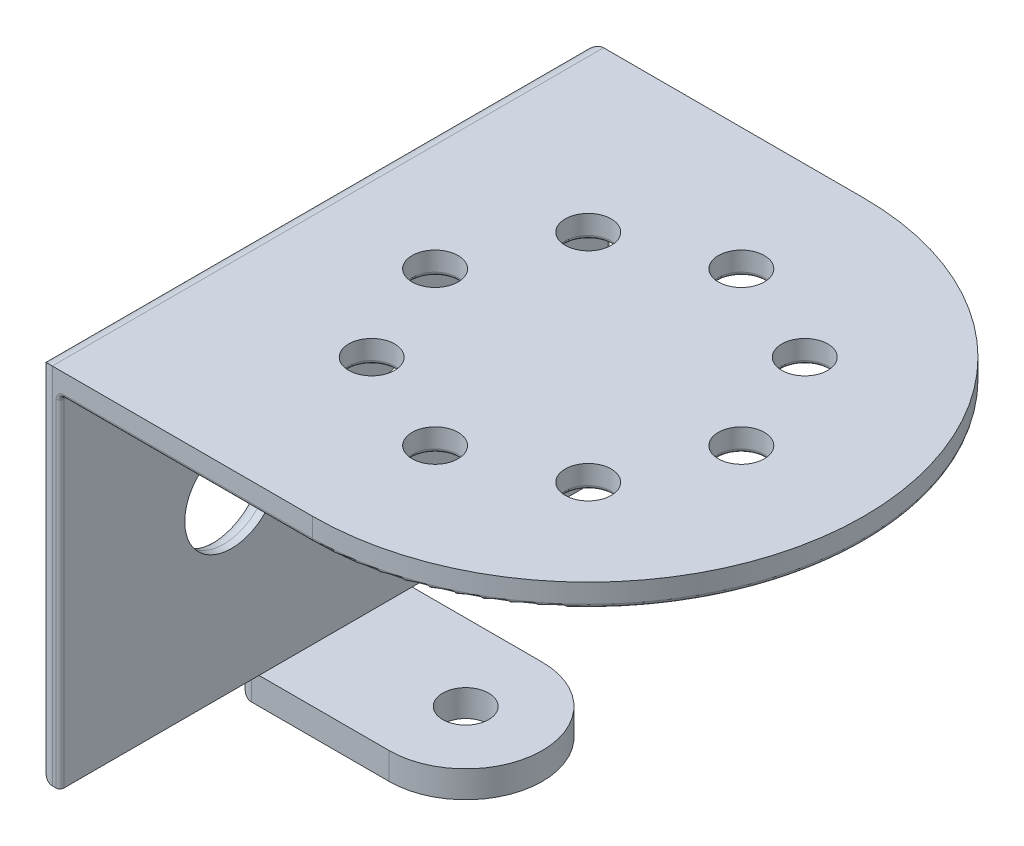
from build123d import *

# Parameters (mm, degrees)
CROQUIS1_W              = 36
CROQUIS1_H              = 22.25
CROQUIS1_R              = 1.5
CROQUIS1_R_2            = 3.05
CROQUIS1_R_3            = 1.875
SALIENTE_EXTRUIR1_DEPTH = 1.5
SALIENTE_EXTRUIR3_START = -22.25
SALIENTE_EXTRUIR3_DEPTH = 1.5
SALIENTE_EXTRUIR4_START = 22.25
CROQUIS4_W              = 1.5
CROQUIS4_H              = 10
SALIENTE_EXTRUIR4_DEPTH = 1.75
CORTAR_EXTRUIR1_REACH   = 48.734
CROQUIS5_R              = 1.5
CORTAR_EXTRUIR2_REACH   = 49.647
CROQUIS7_R              = 1.5
REDONDEO2_R             = 1
REDONDEO3_R             = 0.25


with BuildPart() as part:
    # Croquis1 → Saliente-Extruir1 (new body)
    with BuildSketch(Plane(origin=(0, 0, 0), x_dir=(0, 0, -1), z_dir=(1, 0, 0))):
        Rectangle(CROQUIS1_W, CROQUIS1_H)
        with Locations((13.8, 8.75)):
            Circle(CROQUIS1_R, mode=Mode.SUBTRACT)
        with Locations((-6.8, 0)):
            Circle(CROQUIS1_R_2, mode=Mode.SUBTRACT)
        with Locations(Location((13.8, -8.75, 0), (0, 0, 180))):
            Circle(CROQUIS1_R, mode=Mode.SUBTRACT)
        with Locations((4.2, 0)):
            Circle(CROQUIS1_R_3, mode=Mode.SUBTRACT)
    extrude(amount=SALIENTE_EXTRUIR1_DEPTH)

    # Croquis3<2> → Saliente-Extruir3 (add)
    with BuildSketch(Plane.XZ.offset(11.125).offset(SALIENTE_EXTRUIR3_START)):
        with BuildLine():
            Line((18, -18), (0, -18))
            Line((0, -18), (0, 18))
            Line((0, 18), (18, 18))
            ThreePointArc((18, 18), (36, 0), (18, -18))
        make_face()
    extrude(amount=-SALIENTE_EXTRUIR3_DEPTH)

    # Croquis4 → Saliente-Extruir4 (add)
    with BuildSketch(Plane(origin=(0, 11.125, 0), x_dir=(-1, 0, 0), z_dir=(0, -1, 0)).offset(SALIENTE_EXTRUIR4_START)):
        with BuildLine():
            Line((-1.5, -5), (-1.5, 5))
            Line((-1.5, 5), (-10, 5))
            ThreePointArc((-10, 5), (-15, 0), (-10, -5))
            Line((-10, -5), (-1.5, -5))
        make_face()
        with Locations((-0.75, 0)):
            Rectangle(CROQUIS4_W, CROQUIS4_H)
    extrude(amount=SALIENTE_EXTRUIR4_DEPTH)

    # Croquis5 → Cortar-Extruir1 (cut, up to next)
    with BuildSketch(Plane(origin=(0, -11.125, 0), x_dir=(-1, 0, 0), z_dir=(0, -1, 0)), mode=Mode.PRIVATE) as cortar_extruir1_sk1:
        with Locations(Location((-10, 0, 0), (0, 0, 270))):
            Circle(CROQUIS5_R)
    cortar_extruir1_tool1 = extrude(cortar_extruir1_sk1.sketch, amount=CORTAR_EXTRUIR1_REACH, mode=Mode.PRIVATE) & part.part
    add(cortar_extruir1_tool1.solids().sort_by_distance((10, -11.125, 0))[0], mode=Mode.SUBTRACT)

    # Croquis7 → Cortar-Extruir2 (cut, up to next)
    with BuildSketch(Plane(origin=(0, 12.625, 0), x_dir=(-1, 0, 0), z_dir=(0, 1, 0)), mode=Mode.PRIVATE) as cortar_extruir2_sk1:
        with Locations(Location((-8, 0, 0), (0, 0, 90))):
            Circle(CROQUIS7_R)
    cortar_extruir2_tool1 = extrude(cortar_extruir2_sk1.sketch, amount=-CORTAR_EXTRUIR2_REACH, mode=Mode.PRIVATE) & part.part
    # Croquis7 → Cortar-Extruir2 (cut, up to next)
    with BuildSketch(Plane(origin=(0, 12.625, 0), x_dir=(-1, 0, 0), z_dir=(0, 1, 0)), mode=Mode.PRIVATE) as cortar_extruir2_sk2:
        with Locations(Location((-10.928932188, -7.071067812, 0), (0, 0, 90))):
            Circle(CROQUIS7_R)
    cortar_extruir2_tool2 = extrude(cortar_extruir2_sk2.sketch, amount=-CORTAR_EXTRUIR2_REACH, mode=Mode.PRIVATE) & part.part
    # Croquis7 → Cortar-Extruir2 (cut, up to next)
    with BuildSketch(Plane(origin=(0, 12.625, 0), x_dir=(-1, 0, 0), z_dir=(0, 1, 0)), mode=Mode.PRIVATE) as cortar_extruir2_sk3:
        with Locations(Location((-18, -10, 0), (0, 0, 90))):
            Circle(CROQUIS7_R)
    cortar_extruir2_tool3 = extrude(cortar_extruir2_sk3.sketch, amount=-CORTAR_EXTRUIR2_REACH, mode=Mode.PRIVATE) & part.part
    # Croquis7 → Cortar-Extruir2 (cut, up to next)
    with BuildSketch(Plane(origin=(0, 12.625, 0), x_dir=(-1, 0, 0), z_dir=(0, 1, 0)), mode=Mode.PRIVATE) as cortar_extruir2_sk4:
        with Locations(Location((-25.071067812, -7.071067812, 0), (0, 0, 90))):
            Circle(CROQUIS7_R)
    cortar_extruir2_tool4 = extrude(cortar_extruir2_sk4.sketch, amount=-CORTAR_EXTRUIR2_REACH, mode=Mode.PRIVATE) & part.part
    # Croquis7 → Cortar-Extruir2 (cut, up to next)
    with BuildSketch(Plane(origin=(0, 12.625, 0), x_dir=(-1, 0, 0), z_dir=(0, 1, 0)), mode=Mode.PRIVATE) as cortar_extruir2_sk5:
        with Locations(Location((-28, 0, 0), (0, 0, 90))):
            Circle(CROQUIS7_R)
    cortar_extruir2_tool5 = extrude(cortar_extruir2_sk5.sketch, amount=-CORTAR_EXTRUIR2_REACH, mode=Mode.PRIVATE) & part.part
    # Croquis7 → Cortar-Extruir2 (cut, up to next)
    with BuildSketch(Plane(origin=(0, 12.625, 0), x_dir=(-1, 0, 0), z_dir=(0, 1, 0)), mode=Mode.PRIVATE) as cortar_extruir2_sk6:
        with Locations(Location((-25.071067812, 7.071067812, 0), (0, 0, 90))):
            Circle(CROQUIS7_R)
    cortar_extruir2_tool6 = extrude(cortar_extruir2_sk6.sketch, amount=-CORTAR_EXTRUIR2_REACH, mode=Mode.PRIVATE) & part.part
    # Croquis7 → Cortar-Extruir2 (cut, up to next)
    with BuildSketch(Plane(origin=(0, 12.625, 0), x_dir=(-1, 0, 0), z_dir=(0, 1, 0)), mode=Mode.PRIVATE) as cortar_extruir2_sk7:
        with Locations(Location((-18, 10, 0), (0, 0, 90))):
            Circle(CROQUIS7_R)
    cortar_extruir2_tool7 = extrude(cortar_extruir2_sk7.sketch, amount=-CORTAR_EXTRUIR2_REACH, mode=Mode.PRIVATE) & part.part
    # Croquis7 → Cortar-Extruir2 (cut, up to next)
    with BuildSketch(Plane(origin=(0, 12.625, 0), x_dir=(-1, 0, 0), z_dir=(0, 1, 0)), mode=Mode.PRIVATE) as cortar_extruir2_sk8:
        with Locations(Location((-10.928932188, 7.071067812, 0), (0, 0, 90))):
            Circle(CROQUIS7_R)
    cortar_extruir2_tool8 = extrude(cortar_extruir2_sk8.sketch, amount=-CORTAR_EXTRUIR2_REACH, mode=Mode.PRIVATE) & part.part
    add(cortar_extruir2_tool1.solids().sort_by_distance((8, 12.625, 0))[0], mode=Mode.SUBTRACT)
    add(cortar_extruir2_tool2.solids().sort_by_distance((10.928932, 12.625, -7.071068))[0], mode=Mode.SUBTRACT)
    add(cortar_extruir2_tool3.solids().sort_by_distance((18, 12.625, -10))[0], mode=Mode.SUBTRACT)
    add(cortar_extruir2_tool4.solids().sort_by_distance((25.071068, 12.625, -7.071068))[0], mode=Mode.SUBTRACT)
    add(cortar_extruir2_tool5.solids().sort_by_distance((28, 12.625, 0))[0], mode=Mode.SUBTRACT)
    add(cortar_extruir2_tool6.solids().sort_by_distance((25.071068, 12.625, 7.071068))[0], mode=Mode.SUBTRACT)
    add(cortar_extruir2_tool7.solids().sort_by_distance((18, 12.625, 10))[0], mode=Mode.SUBTRACT)
    add(cortar_extruir2_tool8.solids().sort_by_distance((10.928932, 12.625, 7.071068))[0], mode=Mode.SUBTRACT)

    # Redondeo2
    # the kernel refuses this fillet: 1 mm, written as the material it takes off along each edge
    with BuildSketch(Plane(origin=(0, 8.75, -13.8), x_dir=(0, 0, -1), z_dir=(0, -1, 0))) as redondeo2_piece_1:
        with BuildLine():
            CenterArc((1.5 + REDONDEO2_R, REDONDEO2_R), REDONDEO2_R, 180, 90)
            Line((1.5, REDONDEO2_R), (1.5, 0))
            Line((1.5, 0), (1.5 + REDONDEO2_R, 0))
        make_face()
    revolve(axis=Axis((0, 8.75, -13.8), (1, 0, 0)), mode=Mode.SUBTRACT)
    with BuildSketch(Plane(origin=(0, 0, 6.8), x_dir=(0, 0, -1), z_dir=(0, -1, 0))) as redondeo2_piece_2:
        with BuildLine():
            CenterArc((3.05 + REDONDEO2_R, REDONDEO2_R), REDONDEO2_R, 180, 90)
            Line((3.05, REDONDEO2_R), (3.05, 0))
            Line((3.05, 0), (3.05 + REDONDEO2_R, 0))
        make_face()
    revolve(axis=Axis((0, 0, 6.8), (1, 0, 0)), mode=Mode.SUBTRACT)
    with BuildSketch(Plane(origin=(0, -8.75, -13.8), x_dir=(0, 0, 1), z_dir=(0, 1, 0))) as redondeo2_piece_3:
        with BuildLine():
            CenterArc((1.5 + REDONDEO2_R, REDONDEO2_R), REDONDEO2_R, 180, 90)
            Line((1.5, REDONDEO2_R), (1.5, 0))
            Line((1.5, 0), (1.5 + REDONDEO2_R, 0))
        make_face()
    revolve(axis=Axis((0, -8.75, -13.8), (1, 0, 0)), mode=Mode.SUBTRACT)
    with BuildSketch(Plane(origin=(0, 0, -4.2), x_dir=(0, 0, -1), z_dir=(0, -1, 0))) as redondeo2_piece_4:
        with BuildLine():
            CenterArc((1.875 + REDONDEO2_R, REDONDEO2_R), REDONDEO2_R, 180, 90)
            Line((1.875, REDONDEO2_R), (1.875, 0))
            Line((1.875, 0), (1.875 + REDONDEO2_R, 0))
        make_face()
    revolve(axis=Axis((0, 0, -4.2), (1, 0, 0)), mode=Mode.SUBTRACT)
    with BuildSketch(Plane(origin=(0, 12.625, -20.5), x_dir=(0, -1, 0), z_dir=(0, 0, 1))) as redondeo2_piece_5:
        with BuildLine():
            CenterArc((REDONDEO2_R, REDONDEO2_R), REDONDEO2_R, 180, 90)
            Line((0, REDONDEO2_R), (0, 0))
            Line((0, 0), (REDONDEO2_R, 0))
        make_face()
    extrude(amount=41, mode=Mode.SUBTRACT)
    with BuildSketch(Plane(origin=(0, -11.125, -5), x_dir=(0, 1, 0), z_dir=(0, 0, -1))) as redondeo2_piece_6:
        with BuildLine():
            CenterArc((REDONDEO2_R, REDONDEO2_R), REDONDEO2_R, 180, 90)
            Line((0, REDONDEO2_R), (0, 0))
            Line((0, 0), (REDONDEO2_R, 0))
        make_face()
    extrude(amount=15.5, mode=Mode.SUBTRACT)
    with BuildSketch(Plane(origin=(0, -11.125, -5), x_dir=(0, 0, 1), z_dir=(0, -1, 0))) as redondeo2_piece_7:
        with BuildLine():
            CenterArc((REDONDEO2_R, -REDONDEO2_R), REDONDEO2_R, 90, 90)
            Line((0, -REDONDEO2_R), (0, 0))
            Line((0, 0), (REDONDEO2_R, 0))
        make_face()
    extrude(amount=4.25, mode=Mode.SUBTRACT)
    with BuildSketch(Plane(origin=(0, -11.125, 5), x_dir=(0, 0, -1), z_dir=(0, -1, 0))) as redondeo2_piece_8:
        with BuildLine():
            CenterArc((REDONDEO2_R, REDONDEO2_R), REDONDEO2_R, 180, 90)
            Line((0, REDONDEO2_R), (0, 0))
            Line((0, 0), (REDONDEO2_R, 0))
        make_face()
    extrude(amount=4.25, mode=Mode.SUBTRACT)
    with BuildSketch(Plane(origin=(0, -12.875, 7.5), x_dir=(0, 1, 0), z_dir=(0, 0, -1))) as redondeo2_piece_9:
        with BuildLine():
            CenterArc((REDONDEO2_R, REDONDEO2_R), REDONDEO2_R, 180, 90)
            Line((0, REDONDEO2_R), (0, 0))
            Line((0, 0), (REDONDEO2_R, 0))
        make_face()
    extrude(amount=15, mode=Mode.SUBTRACT)
    with BuildSketch(Plane(origin=(0, -11.125, 20.5), x_dir=(1, 0, 0), z_dir=(0, 0, -1))) as redondeo2_piece_10:
        with BuildLine():
            CenterArc((REDONDEO2_R, -REDONDEO2_R), REDONDEO2_R, 90, 90)
            Line((0, -REDONDEO2_R), (0, 0))
            Line((0, 0), (REDONDEO2_R, 0))
        make_face()
    extrude(amount=15.5, mode=Mode.SUBTRACT)
    with BuildSketch(Plane(origin=(0, 15.125, 18), x_dir=(0, 0, -1), z_dir=(0, -1, 0)), Plane(origin=(0, -13.625, -18), x_dir=(0, 0, 1), z_dir=(0, 1, 0))) as redondeo2_piece_11:
        with BuildLine():
            CenterArc((REDONDEO2_R, REDONDEO2_R), REDONDEO2_R, 180, 90)
            Line((0, REDONDEO2_R), (0, 0))
            Line((0, 0), (REDONDEO2_R, 0))
        make_face()
    extrude(amount=28.75, mode=Mode.SUBTRACT)
    with BuildSketch(Plane(origin=(0, -8.625, -5), x_dir=(0, 0, 1), z_dir=(0, -1, 0))) as redondeo2_piece_12a_section:
        with BuildLine():
            CenterArc((REDONDEO2_R, -REDONDEO2_R), REDONDEO2_R, 90, 90)
            Line((0, -REDONDEO2_R), (0, 0))
            Line((0, 0), (REDONDEO2_R, 0))
        make_face()
    redondeo2_piece_12a = extrude(amount=6.75, mode=Mode.PRIVATE)
    redondeo2_piece_12a = split(redondeo2_piece_12a, bisect_by=Plane(origin=(0.226395114, -11.125, -4.773604886), z_dir=(0, 1, 0)), keep=Keep.TOP, mode=Mode.PRIVATE)
    with BuildSketch(Plane(origin=(0, -11.125, -2.5), x_dir=(0, 1, 0), z_dir=(0, 0, -1))) as redondeo2_piece_12b_section:
        with BuildLine():
            CenterArc((REDONDEO2_R, REDONDEO2_R), REDONDEO2_R, 180, 90)
            Line((0, REDONDEO2_R), (0, 0))
            Line((0, 0), (REDONDEO2_R, 0))
        make_face()
    redondeo2_piece_12b = extrude(amount=18, mode=Mode.PRIVATE)
    redondeo2_piece_12b = split(redondeo2_piece_12b, bisect_by=Plane(origin=(0.226395114, -10.898604886, -5), z_dir=(0, 0, 1)), keep=Keep.TOP, mode=Mode.PRIVATE)
    redondeo2_piece_12 = redondeo2_piece_12a & redondeo2_piece_12b
    add(redondeo2_piece_12, mode=Mode.SUBTRACT)
    with BuildSketch(Plane(origin=(0, -11.125, 20.5), x_dir=(1, 0, 0), z_dir=(0, 0, -1))) as redondeo2_piece_13a_section:
        with BuildLine():
            CenterArc((REDONDEO2_R, -REDONDEO2_R), REDONDEO2_R, 90, 90)
            Line((0, -REDONDEO2_R), (0, 0))
            Line((0, 0), (REDONDEO2_R, 0))
        make_face()
    redondeo2_piece_13a = extrude(amount=18, mode=Mode.PRIVATE)
    redondeo2_piece_13a = split(redondeo2_piece_13a, bisect_by=Plane(origin=(0.226395114, -10.898604886, 5), z_dir=(0, 0, -1)), keep=Keep.TOP, mode=Mode.PRIVATE)
    with BuildSketch(Plane(origin=(0, -8.625, 5), x_dir=(0, 0, -1), z_dir=(0, -1, 0))) as redondeo2_piece_13b_section:
        with BuildLine():
            CenterArc((REDONDEO2_R, REDONDEO2_R), REDONDEO2_R, 180, 90)
            Line((0, REDONDEO2_R), (0, 0))
            Line((0, 0), (REDONDEO2_R, 0))
        make_face()
    redondeo2_piece_13b = extrude(amount=6.75, mode=Mode.PRIVATE)
    redondeo2_piece_13b = split(redondeo2_piece_13b, bisect_by=Plane(origin=(0.226395114, -11.125, 4.773604886), z_dir=(0, 1, 0)), keep=Keep.TOP, mode=Mode.PRIVATE)
    redondeo2_piece_13 = redondeo2_piece_13a & redondeo2_piece_13b
    add(redondeo2_piece_13, mode=Mode.SUBTRACT)

    # Redondeo3
    redondeo3_edges = [part.edges().sort_by_distance(p)[0] for p in [
        (1.5, 0, 18),
        (9.75, 11.125, -18),
        (36, 11.125, 0),
        (9.75, 11.125, 18),
        (1.5, 0, -18),
        (10.928932188, 11.125, 5.571067812),
        (18, 11.125, 8.5),
        (25.071067812, 11.125, 5.571067812),
        (28, 11.125, -1.5),
        (25.071067812, 11.125, -8.571067812),
        (18, 11.125, -11.5),
        (10.928932188, 11.125, -8.571067812),
        (8, 11.125, -1.5),
        (1.5, 11.125, 0),
    ]]
    fillet(redondeo3_edges, radius=REDONDEO3_R)


solid = part.part
